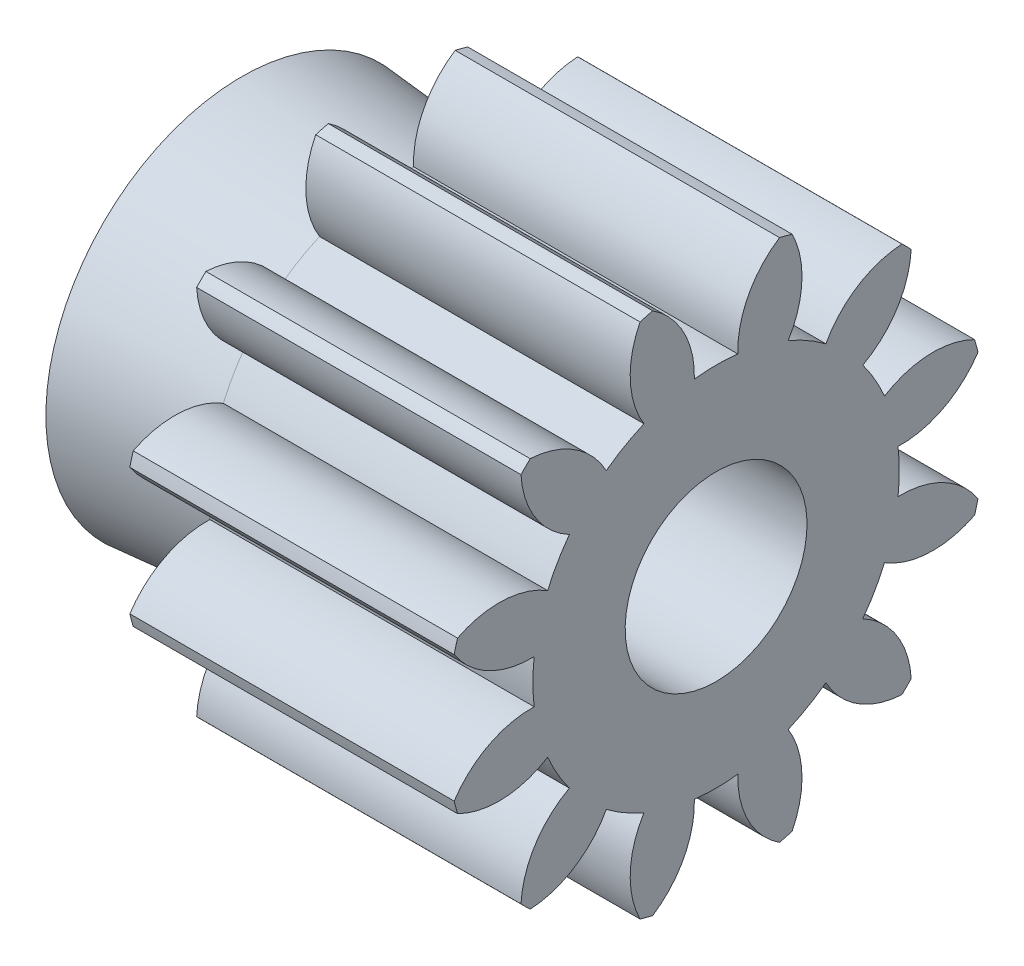
from build123d import *

# Parameters (mm, degrees)
BASPROSKE_W             = 12.7
BASPROSKE_H             = 8.89
TOOTHCUT_DEPTH          = 18.870484045
TEETHCUTS_COUNT         = 12
TEETHCUTS_ANGLE         = 330
BORSKE_R                = 3
BORE_DEPTH              = 50.8000508
CUT_EXTRUDE1_DEPTH      = 18.6238176
CUT_EXTRUDE1_DEPTH_BACK = 18.6238176
SKETCH2_W               = 2
SKETCH2_H               = 17.280564042


with BuildPart() as part:
    # BasProSke → Base-Revolve (revolve)
    with BuildSketch(Plane(origin=(0, 0, 0), x_dir=(1, 0, 0), z_dir=(0, 1, 0))):
        with Locations((6.35, 4.445)):
            Rectangle(BASPROSKE_W, BASPROSKE_H)
    revolve(axis=Axis((-10, 0, 0), (1, 0, 0)))

    # TooCutSke → ToothCut (cut, through all)
    with BuildSketch(Plane(origin=(0, 0, 0), x_dir=(0, 0, -1), z_dir=(1, 0, 0))):
        with BuildLine():
            ThreePointArc((0.717076553, 6.002519826), (0, 6.0452), (-0.717076553, 6.002519826))
            ThreePointArc((-0.717076553, 6.002519826), (-1.069160545, 7.516029346), (-2.121611652, 8.659279483))
            ThreePointArc((-2.121611652, 8.659279483), (0, 8.9154), (2.121611652, 8.659279483))
            ThreePointArc((2.121611652, 8.659279483), (1.069160545, 7.516029346), (0.717076553, 6.002519826))
        make_face()
    toothcut = extrude(amount=TOOTHCUT_DEPTH, mode=Mode.SUBTRACT)

    # TeethCuts: ToothCut ×12 about axis
    teethcuts_axis = Axis((-10, 0, 0), (1, 0, 0))
    for i in range(1, TEETHCUTS_COUNT):
        add(toothcut.rotate(teethcuts_axis, i * TEETHCUTS_ANGLE / (TEETHCUTS_COUNT - 1)), mode=Mode.SUBTRACT)

    # BorSke → Bore (cut, symmetric)
    with BuildSketch(Plane(origin=(0, 0, 0), x_dir=(0, 0, -1), z_dir=(1, 0, 0))):
        Circle(BORSKE_R)
    extrude(amount=BORE_DEPTH, both=True, mode=Mode.SUBTRACT)

    # Sketch1 → Revolve1 (revolve)
    with BuildSketch(Plane.XY):
        Polygon((0, -4.46), (-4.95, -4.46), (-4.95, -6.46), (0, -6.0452), align=None)
    revolve(axis=Axis((0, 0, 0), (-1, 0, 0)))

    # Sketch2 → Cut-Extrude1 (cut, two sides: drawn at the far end of the back side and taken through both)
    with BuildSketch(Plane.XY.offset(-CUT_EXTRUDE1_DEPTH_BACK)):
        with Locations((11.7, 0)):
            Rectangle(SKETCH2_W, SKETCH2_H)
    extrude(amount=CUT_EXTRUDE1_DEPTH + CUT_EXTRUDE1_DEPTH_BACK, mode=Mode.SUBTRACT)


solid = part.part
